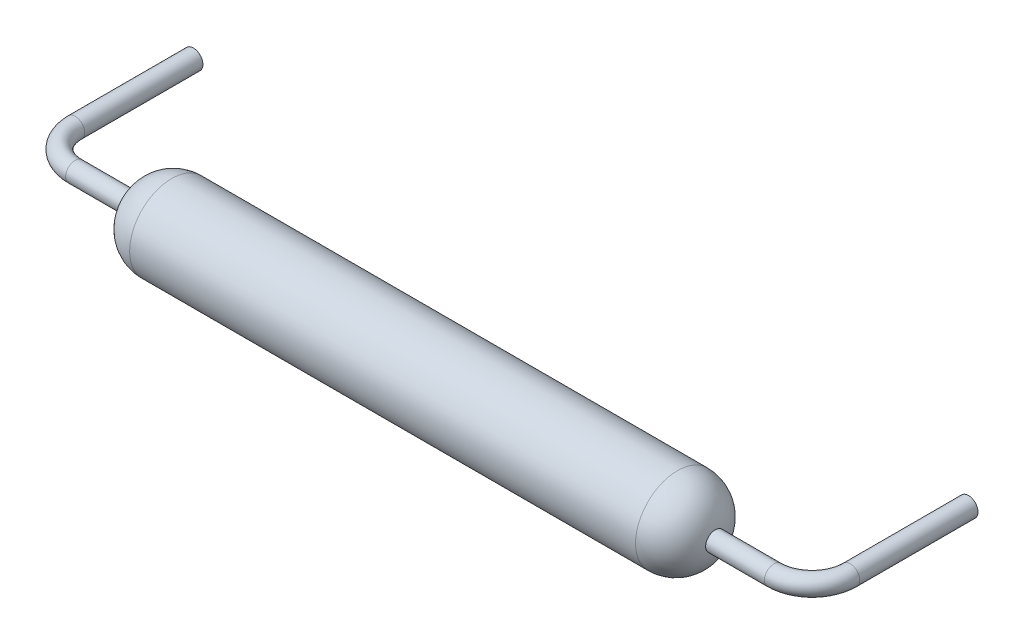
from build123d import *

# Parameters (mm, degrees)
EXTRUDE1_START = 2.54
SKETCH1_R      = 1.1
EXTRUDE1_DEPTH = 7.62
SKETCH3_R      = 0.25
FILLET1_R      = 1


with BuildPart() as part:
    # Sketch1 → Extrude1 (new body)
    with BuildSketch(Plane(origin=(0, 0, 0), x_dir=(0, 0, -1), z_dir=(1, 0, 0)).offset(EXTRUDE1_START)):
        with Locations((-1.1, 0)):
            Circle(SKETCH1_R)
    extrude(amount=EXTRUDE1_DEPTH)

    # Sweep1: sweep along a path in Sketch2
    with BuildLine(Plane(origin=(0, 0, 0), x_dir=(1, 0, 0), z_dir=(0, 1, 0))) as sweep1_path:
        Line((2.54, -1.1), (1, -1.1))
        ThreePointArc((1, -1.1), (0.292893219, -0.807106781), (0, -0.1))
        Line((0, -0.1), (0, 3))
    # Sketch3 → Sweep1 (sweep)
    with BuildSketch(Plane.ZY.offset(-2.54)):
        with Locations((1.1, 0)):
            Circle(SKETCH3_R)
    sweep(path=sweep1_path.line)

    # Fillet1
    # the kernel refuses this fillet: 1 mm, written as the material it takes off along each edge
    with BuildSketch(Plane(origin=(2.54, 0, 1.1), x_dir=(0, 0, -1), z_dir=(0, -1, 0))) as fillet1_piece_1:
        with BuildLine():
            CenterArc((0.1, 0.988685997), FILLET1_R, 278.626926559, 81.373073441)
            Line((0.25, 0), (0.253, -0.01977372))
            ThreePointArc((0.253, -0.01977372), (0.675, -0.02), (1.1, -0.02))
            Line((1.1, -0.02), (1.12, 0))
            Line((1.12, 0), (1.12, 0.988685997))
            Line((1.12, 0.988685997), (1.1, 0.988685997))
        make_face()
    revolve(axis=Axis((2.54, 0, 1.1), (1, 0, 0)), mode=Mode.SUBTRACT)

    # Mirror1: part across plane


with BuildPart() as part_1:
    add(part.part)
    add(part.part.mirror(Plane(origin=(10.16, 0, 1.1), x_dir=(0, 0, 1), z_dir=(1, 0, 0))))


solid = part_1.part
